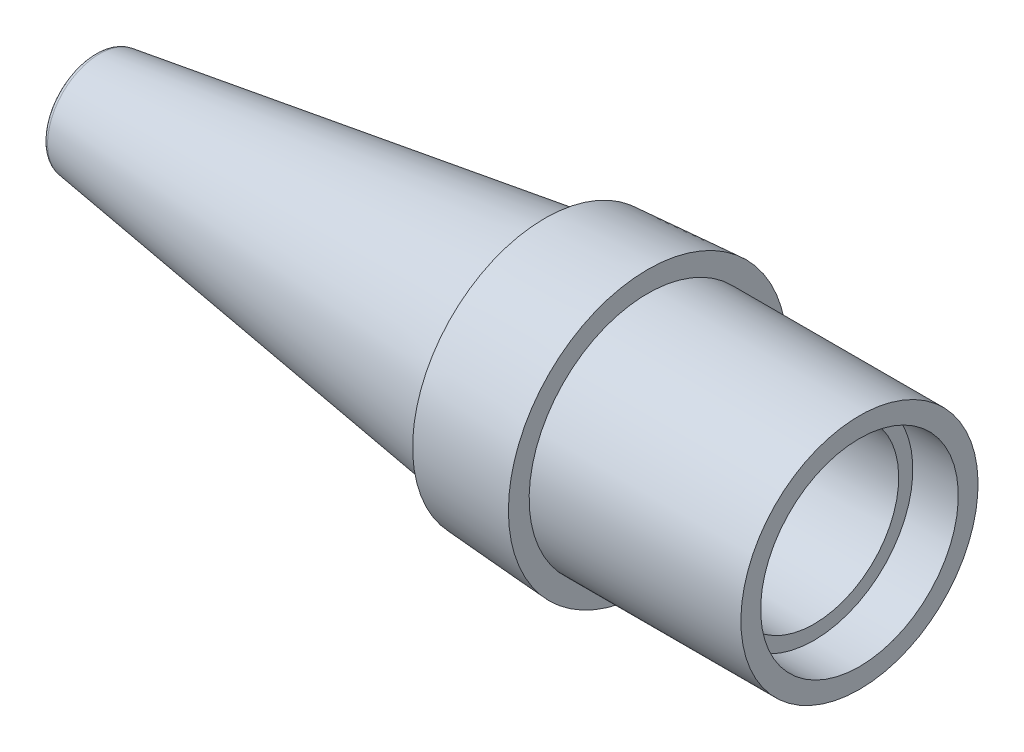
from build123d import *

# Parameters (mm, degrees)
VARREDURA_DE_CORTE1_PITCH = 0.29
VARREDURA_DE_CORTE1_TO    = 4.89
ESBO_O5_W                 = 7.5
ESBO_O5_H                 = 0.7


with BuildPart() as part:
    # Esboço1 → Revolução1 (revolve)
    with BuildSketch(Plane.XY, mode=Mode.PRIVATE) as revolu_o1_sk:
        with BuildLine():
            Line((15.95, 4.687305212), (19.59, 4.935))
            Line((19.59, 4.935), (19.59, 3.4))
            Line((19.59, 3.4), (20.59, 3.4))
            Line((20.59, 3.4), (20.59, 3.65))
            Line((20.59, 3.65), (25.48, 3.65))
            Line((25.48, 3.65), (25.48, 3))
            Line((25.48, 3), (9.554333501, 2.73073597))
            Line((9.554333501, 2.73073597), (0, 1.35))
            Line((0, 1.35), (0, 1.64182518))
            ThreePointArc((0, 1.64182518), (0.04880289, 1.772742841), (0.17139434, 1.8397689))
            Line((0.17139434, 1.8397689), (15.77860566, 4.0952311))
            ThreePointArc((15.77860566, 4.0952311), (15.90119711, 4.162257159), (15.95, 4.29317482))
            Line((15.95, 4.29317482), (15.95, 4.687305212))
        make_face()
    revolve(revolu_o1_sk.sketch.rotate(Axis((0, 0, 0), (1, 0, 0)), 180), axis=Axis((0, 0, 0), (1, 0, 0)))

    # Varredura de corte1: arcs per turn and ends read off the stored shape
    # Varredura de corte1: the profile of Esboço3 screwed along a right-hand helix through 21 turns, 6 arcs to a turn; built about Z, then put on its axis
    varredura_de_corte1_z = Axis((0, 0, 0), (0, 0, 1))
    varredura_de_corte1_corners = [(3.98, -6.95e-07, -0.542425143), (3.48, -6.07e-07, -0.253750008), (3.98, -6.95e-07, 0.034925127)]
    with BuildLine(mode=Mode.PRIVATE) as varredura_de_corte1_profile:
        Line(varredura_de_corte1_corners[0], varredura_de_corte1_corners[1])
        Line(varredura_de_corte1_corners[1], varredura_de_corte1_corners[2])
        Line(varredura_de_corte1_corners[2], varredura_de_corte1_corners[0])
    varredura_de_corte1_cap = Face(varredura_de_corte1_profile.wire())
    varredura_de_corte1_turn_angles = [0, 30, 60, 90, 120, 150, 180, 210, 240, 270, 300, 330, 360]
    varredura_de_corte1_turn_weights = [1, 0.8660254037844387, 1, 0.8660254037844387, 1, 0.8660254037844387, 1, 0.8660254037844387, 1, 0.8660254037844387, 1, 0.8660254037844387, 1]
    varredura_de_corte1_turn_rails = [Edge.make_bspline([Vector(p[0], p[1], 0).rotate(varredura_de_corte1_z, varredura_de_corte1_turn_angles[k]) / varredura_de_corte1_turn_weights[k] + Vector(0, 0, p[2] + VARREDURA_DE_CORTE1_PITCH * varredura_de_corte1_turn_angles[k] / 360) for k in range(13)], [0, 0, 0, 1, 1, 2, 2, 3, 3, 4, 4, 5, 5, 6, 6, 6], 2, varredura_de_corte1_turn_weights) for p in varredura_de_corte1_corners]
    varredura_de_corte1_turn_sides = [Face.make_surface_from_curves(varredura_de_corte1_turn_rails[p[0]], varredura_de_corte1_turn_rails[p[1]]) for p in [(0, 1), (1, 2), (2, 0)]]
    varredura_de_corte1_turn = Solid(Shell([*varredura_de_corte1_turn_sides, varredura_de_corte1_cap, varredura_de_corte1_cap.rotate(varredura_de_corte1_z, 360).moved(Location((0, 0, VARREDURA_DE_CORTE1_PITCH * 360 / 360)))]))
    varredura_de_corte1_each = [*[varredura_de_corte1_turn.moved(Location((0, 0, VARREDURA_DE_CORTE1_PITCH * i))) for i in range(21)]]
    add(Plane(origin=(25.48, 0, 0), x_dir=(0, 0.7071067811865464, 0.7071067811865487), z_dir=(-1, 0, 0)) * split(Compound([varredura_de_corte1_each[i] for i in range(0, 21, 2)]), bisect_by=Plane.XY.offset(VARREDURA_DE_CORTE1_TO), keep=Keep.BOTTOM, mode=Mode.PRIVATE), mode=Mode.SUBTRACT)
    add(Plane(origin=(25.48, 0, 0), x_dir=(0, 0.7071067811865464, 0.7071067811865487), z_dir=(-1, 0, 0)) * split(Compound([varredura_de_corte1_each[i] for i in range(1, 21, 2)]), bisect_by=Plane.XY.offset(VARREDURA_DE_CORTE1_TO), keep=Keep.BOTTOM, mode=Mode.PRIVATE), mode=Mode.SUBTRACT)


with BuildPart() as body_2:
    # Esboço5 → Revolução2 (revolve)
    with BuildSketch(Plane.XY, mode=Mode.PRIVATE) as revolu_o2_sk:
        with Locations((23.34, 3.85)):
            Rectangle(ESBO_O5_W, ESBO_O5_H)
    revolve(revolu_o2_sk.sketch.rotate(Axis((18.177251489, 0, 0), (1, 0, 0)), 180), axis=Axis((18.177251489, 0, 0), (1, 0, 0)))


solid = Compound([part.part, body_2.part])
